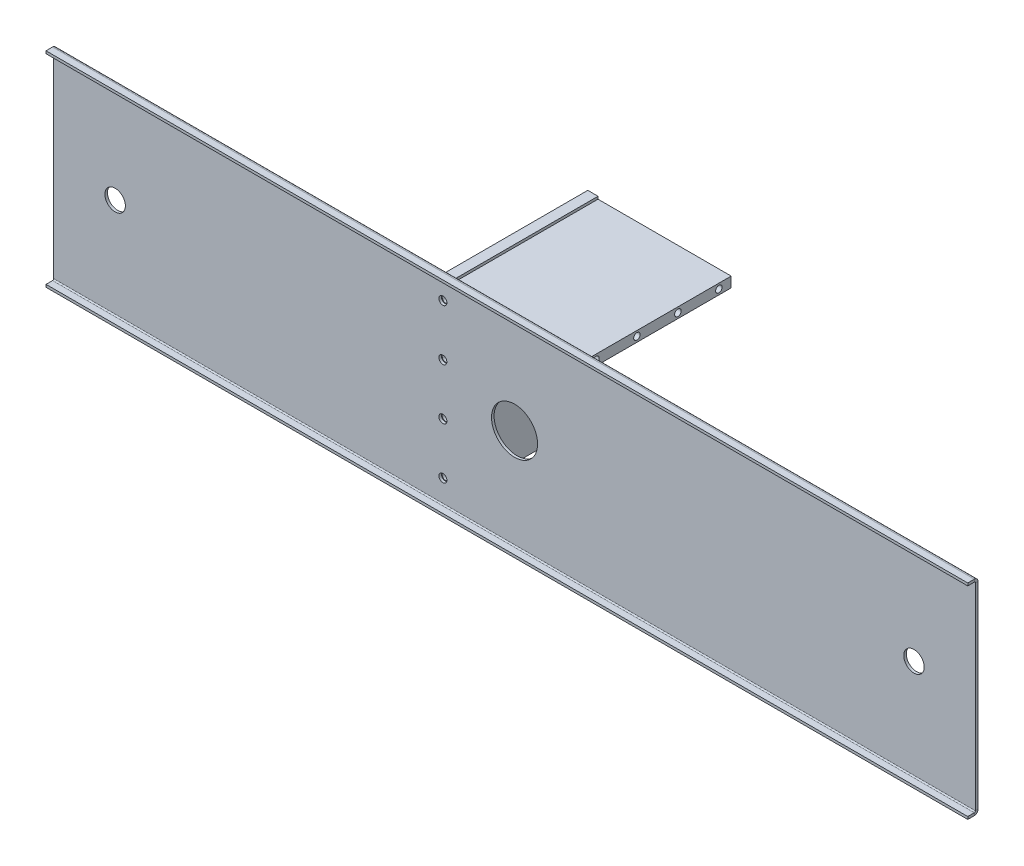
from build123d import *

# Parameters (mm, degrees)
SKETCH2_W                       = 571.5
SKETCH2_H                       = 127
SKETCH2_R                       = 6.35
SKETCH2_R_2                     = 14.2875
BASE_FLANGE1_DEPTH              = 1.5875
EDGE_FLANGE1_STRIP_W            = 7.8232
EDGE_FLANGE1_STRIP_H            = 1.5875
EDGE_FLANGE1_STRIP_CUT_DEPTH    = 571.5
EDGE_FLANGE1_DEPTH              = 571.5
EDGE_FLANGE3_STRIP_W            = 7.8232
EDGE_FLANGE3_STRIP_H            = 1.5875
EDGE_FLANGE3_STRIP_CUT_DEPTH    = 571.5
EDGE_FLANGE3_DEPTH              = 571.5
SKETCH18_W                      = 6.35
SKETCH18_H                      = 117.475
BOSS_EXTRUDE1_DEPTH             = 45.72
SKETCH24_W                      = 15.875
SKETCH24_H                      = 12.7
CUT_EXTRUDE1_DEPTH              = 6.35
SKETCH25_R                      = 2.4892
CUT_EXTRUDE2_DEPTH              = 1.5875
F_10_32_TAPPED_HOLE1_AT_2_COUNT = 2
F_10_32_TAPPED_HOLE1_AT_2_PITCH = 31.75
F_10_32_TAPPED_HOLE1_AT_3_COUNT = 2
F_10_32_TAPPED_HOLE1_AT_3_PITCH = 63.5
F_10_32_TAPPED_HOLE1_AT_4_COUNT = 2
F_10_32_TAPPED_HOLE1_AT_4_PITCH = 95.25
SKETCH29_W                      = 91.44
SKETCH29_H                      = 6.35
BOSS_EXTRUDE2_DEPTH             = 82.55
SKETCH32_R                      = 2.4892
CUT_EXTRUDE3_DEPTH              = 6.35
F_10_32_TAPPED_HOLE2_AT_2_COUNT = 2
F_10_32_TAPPED_HOLE2_AT_2_PITCH = 25.4
F_10_32_TAPPED_HOLE2_AT_3_COUNT = 2
F_10_32_TAPPED_HOLE2_AT_3_PITCH = 50.8
F_10_32_TAPPED_HOLE2_AT_4_COUNT = 2
F_10_32_TAPPED_HOLE2_AT_4_PITCH = 76.2


# Sheet-metal steps are written as plain solids
with BuildPart() as part:
    # Sketch2 → Base-Flange1 (new body)
    with BuildSketch(Plane.XY.offset(45.72)):
        Rectangle(SKETCH2_W, SKETCH2_H)
        with Locations((-247.641580503, 0)):
            Circle(SKETCH2_R, mode=Mode.SUBTRACT)
        Circle(SKETCH2_R_2, mode=Mode.SUBTRACT)
        with Locations((247.641580503, 0)):
            Circle(SKETCH2_R, mode=Mode.SUBTRACT)
    extrude(amount=BASE_FLANGE1_DEPTH)

    # Edge-Flange1 strip (across the edge) → Edge-Flange1 strip cut (cut)
    with BuildSketch(Plane(origin=(285.75, 63.5, 47.3075), x_dir=(0, -1, 0), z_dir=(-1, 0, 0))):
        with Locations((-1.5875, -0.79375)):
            Rectangle(EDGE_FLANGE1_STRIP_W, EDGE_FLANGE1_STRIP_H)
    extrude(amount=EDGE_FLANGE1_STRIP_CUT_DEPTH, mode=Mode.SUBTRACT)

    # Edge-Flange1 section (across the edge) → Edge-Flange1 (add)
    with BuildSketch(Plane(origin=(285.75, 63.5, 47.3075), x_dir=(0, -1, 0), z_dir=(-1, 0, 0))):
        with BuildLine():
            Line((0, 0.7366), (0, 4.7625))
            Line((0, 4.7625), (1.5875, 4.7625))
            Line((1.5875, 4.7625), (1.5875, 0.7366))
            ThreePointArc((1.5875, 0.7366), (1.803245145, 0.215745145), (2.3241, 0))
            Line((2.3241, 0), (2.3241, -1.5875))
            ThreePointArc((2.3241, -1.5875), (0.68071313, -0.90678687), (0, 0.7366))
        make_face()
    extrude(amount=EDGE_FLANGE1_DEPTH)

    # Edge-Flange3 strip (across the edge) → Edge-Flange3 strip cut (cut)
    with BuildSketch(Plane(origin=(-285.75, -63.5, 47.3075), x_dir=(0, 1, 0), z_dir=(1, 0, 0))):
        with Locations((-1.5875, -0.79375)):
            Rectangle(EDGE_FLANGE3_STRIP_W, EDGE_FLANGE3_STRIP_H)
    extrude(amount=EDGE_FLANGE3_STRIP_CUT_DEPTH, mode=Mode.SUBTRACT)

    # Edge-Flange3 section (across the edge) → Edge-Flange3 (add)
    with BuildSketch(Plane(origin=(-285.75, -63.5, 47.3075), x_dir=(0, 1, 0), z_dir=(1, 0, 0))):
        with BuildLine():
            Line((0, 0.7366), (0, 4.7625))
            Line((0, 4.7625), (1.5875, 4.7625))
            Line((1.5875, 4.7625), (1.5875, 0.7366))
            ThreePointArc((1.5875, 0.7366), (1.803245145, 0.215745145), (2.3241, 0))
            Line((2.3241, 0), (2.3241, -1.5875))
            ThreePointArc((2.3241, -1.5875), (0.68071313, -0.90678687), (0, 0.7366))
        make_face()
    extrude(amount=EDGE_FLANGE3_DEPTH)

    # Sketch25 → Cut-Extrude2 (cut)
    with BuildSketch(Plane.XY.offset(47.3075)):
        with Locations((-44.45, 47.625)):
            Circle(SKETCH25_R)
        with Locations((-44.45, 15.875)):
            Circle(SKETCH25_R)
        with Locations((-44.45, -15.875)):
            Circle(SKETCH25_R)
        with Locations((-44.45, -47.625)):
            Circle(SKETCH25_R)
    extrude(amount=-CUT_EXTRUDE2_DEPTH, mode=Mode.SUBTRACT)


with BuildPart() as body_2:
    # Sketch18 → Boss-Extrude1 (new, symmetric)
    with BuildSketch(Plane.XY):
        with Locations((-44.45, 0)):
            Rectangle(SKETCH18_W, SKETCH18_H)
    extrude(amount=BOSS_EXTRUDE1_DEPTH, both=True)

    # Sketch24 → Cut-Extrude1 (cut)
    with BuildSketch(Plane(origin=(-41.275, 0, 0), x_dir=(0, 0, -1), z_dir=(1, 0, 0))):
        with Locations((-37.7825, 32.5755)):
            Rectangle(SKETCH24_W, SKETCH24_H)
        with Locations((-37.7825, -32.5755)):
            Rectangle(SKETCH24_W, SKETCH24_H)
    extrude(amount=-CUT_EXTRUDE1_DEPTH, mode=Mode.SUBTRACT)

    # Sketch28 → #10-32 Tapped Hole1 (revolve, cut)
    with BuildSketch(Plane(origin=(-44.45, 47.625, 45.72), x_dir=(0, -1, 0), z_dir=(1, 0, 0))):
        Polygon((0, 0), (0, 13.913317848), (2.0193, 12.7), (2.0193, 0), align=None)
    f_10_32_tapped_hole1 = revolve(axis=Axis((-44.45, 47.625, 52.07), (0, 0, -1)), mode=Mode.SUBTRACT)

    # #10-32 Tapped Hole1 at 2: #10-32 Tapped Hole1 ×2
    with Locations(*[(0, -i * F_10_32_TAPPED_HOLE1_AT_2_PITCH, 0) for i in range(1, F_10_32_TAPPED_HOLE1_AT_2_COUNT)]):
        add(f_10_32_tapped_hole1, mode=Mode.SUBTRACT)

    # #10-32 Tapped Hole1 at 3: #10-32 Tapped Hole1 ×2
    with Locations(*[(0, -i * F_10_32_TAPPED_HOLE1_AT_3_PITCH, 0) for i in range(1, F_10_32_TAPPED_HOLE1_AT_3_COUNT)]):
        add(f_10_32_tapped_hole1, mode=Mode.SUBTRACT)

    # #10-32 Tapped Hole1 at 4: #10-32 Tapped Hole1 ×2
    with Locations(*[(0, -i * F_10_32_TAPPED_HOLE1_AT_4_PITCH, 0) for i in range(1, F_10_32_TAPPED_HOLE1_AT_4_COUNT)]):
        add(f_10_32_tapped_hole1, mode=Mode.SUBTRACT)

    # Sketch32 → Cut-Extrude3 (cut)
    with BuildSketch(Plane.ZY.offset(47.625)):
        with Locations((-38.1, 53.975)):
            Circle(SKETCH32_R)
        with Locations((-12.7, 53.975)):
            Circle(SKETCH32_R)
        with Locations((12.7, 53.975)):
            Circle(SKETCH32_R)
        with Locations((38.1, 53.975)):
            Circle(SKETCH32_R)
    extrude(amount=-CUT_EXTRUDE3_DEPTH, mode=Mode.SUBTRACT)

    # Mirror2: #10-32 Tapped Hole1 across plane
    add(f_10_32_tapped_hole1.mirror(Plane.XY), mode=Mode.SUBTRACT)

    # Mirror2 copy 1 sketch → Mirror2 copy 1 (revolve, cut)
    with BuildSketch(Plane(origin=(-44.45, 15.875, -45.72), x_dir=(0, -1, 0), z_dir=(1, 0, 0))):
        Polygon((0, 0), (0, -13.913317848), (2.0193, -12.7), (2.0193, 0), align=None)
    revolve(axis=Axis((-44.45, 15.875, -52.07), (0, 0, -1)), mode=Mode.SUBTRACT)

    # Mirror2 copy 2 sketch → Mirror2 copy 2 (revolve, cut)
    with BuildSketch(Plane(origin=(-44.45, -15.875, -45.72), x_dir=(0, -1, 0), z_dir=(1, 0, 0))):
        Polygon((0, 0), (0, -13.913317848), (2.0193, -12.7), (2.0193, 0), align=None)
    revolve(axis=Axis((-44.45, -15.875, -52.07), (0, 0, -1)), mode=Mode.SUBTRACT)

    # Mirror2 copy 3 sketch → Mirror2 copy 3 (revolve, cut)
    with BuildSketch(Plane(origin=(-44.45, -47.625, -45.72), x_dir=(0, -1, 0), z_dir=(1, 0, 0))):
        Polygon((0, 0), (0, -13.913317848), (2.0193, -12.7), (2.0193, 0), align=None)
    revolve(axis=Axis((-44.45, -47.625, -52.07), (0, 0, -1)), mode=Mode.SUBTRACT)


with BuildPart() as body_3:
    # Sketch29 → Boss-Extrude2 (new body)
    with BuildSketch(Plane(origin=(-41.275, 0, 0), x_dir=(0, 0, -1), z_dir=(1, 0, 0))):
        with Locations((0, 53.975)):
            Rectangle(SKETCH29_W, SKETCH29_H)
    extrude(amount=BOSS_EXTRUDE2_DEPTH)

    # Sketch34 → #10-32 Tapped Hole2 (revolve, cut)
    with BuildSketch(Plane(origin=(-41.275, 53.975, -38.1), x_dir=(0, 0, 1), z_dir=(0, 1, 0))):
        Polygon((0, 0), (0, 13.913317848), (2.0193, 12.7), (2.0193, 0), align=None)
    f_10_32_tapped_hole2 = revolve(axis=Axis((-47.625, 53.975, -38.1), (1, 0, 0)), mode=Mode.SUBTRACT)

    # #10-32 Tapped Hole2 at 2: #10-32 Tapped Hole2 ×2
    with Locations(*[(0, 0, i * F_10_32_TAPPED_HOLE2_AT_2_PITCH) for i in range(1, F_10_32_TAPPED_HOLE2_AT_2_COUNT)]):
        add(f_10_32_tapped_hole2, mode=Mode.SUBTRACT)

    # #10-32 Tapped Hole2 at 3: #10-32 Tapped Hole2 ×2
    with Locations(*[(0, 0, i * F_10_32_TAPPED_HOLE2_AT_3_PITCH) for i in range(1, F_10_32_TAPPED_HOLE2_AT_3_COUNT)]):
        add(f_10_32_tapped_hole2, mode=Mode.SUBTRACT)

    # #10-32 Tapped Hole2 at 4: #10-32 Tapped Hole2 ×2
    with Locations(*[(0, 0, i * F_10_32_TAPPED_HOLE2_AT_4_PITCH) for i in range(1, F_10_32_TAPPED_HOLE2_AT_4_COUNT)]):
        add(f_10_32_tapped_hole2, mode=Mode.SUBTRACT)

    # Mirror1: #10-32 Tapped Hole2 across plane
    add(f_10_32_tapped_hole2.mirror(Plane(origin=(0, 0, 0), x_dir=(0, 0, 1), z_dir=(1, 0, 0))), mode=Mode.SUBTRACT)

    # Mirror1 copy 1 sketch → Mirror1 copy 1 (revolve, cut)
    with BuildSketch(Plane(origin=(41.275, 53.975, -12.7), x_dir=(0, 0, 1), z_dir=(0, 1, 0))):
        Polygon((0, 0), (0, -13.913317848), (2.0193, -12.7), (2.0193, 0), align=None)
    revolve(axis=Axis((47.625, 53.975, -12.7), (1, 0, 0)), mode=Mode.SUBTRACT)

    # Mirror1 copy 2 sketch → Mirror1 copy 2 (revolve, cut)
    with BuildSketch(Plane(origin=(41.275, 53.975, 12.7), x_dir=(0, 0, 1), z_dir=(0, 1, 0))):
        Polygon((0, 0), (0, -13.913317848), (2.0193, -12.7), (2.0193, 0), align=None)
    revolve(axis=Axis((47.625, 53.975, 12.7), (1, 0, 0)), mode=Mode.SUBTRACT)

    # Mirror1 copy 3 sketch → Mirror1 copy 3 (revolve, cut)
    with BuildSketch(Plane(origin=(41.275, 53.975, 38.1), x_dir=(0, 0, 1), z_dir=(0, 1, 0))):
        Polygon((0, 0), (0, -13.913317848), (2.0193, -12.7), (2.0193, 0), align=None)
    revolve(axis=Axis((47.625, 53.975, 38.1), (1, 0, 0)), mode=Mode.SUBTRACT)


solid = Compound([part.part, body_2.part, body_3.part])
